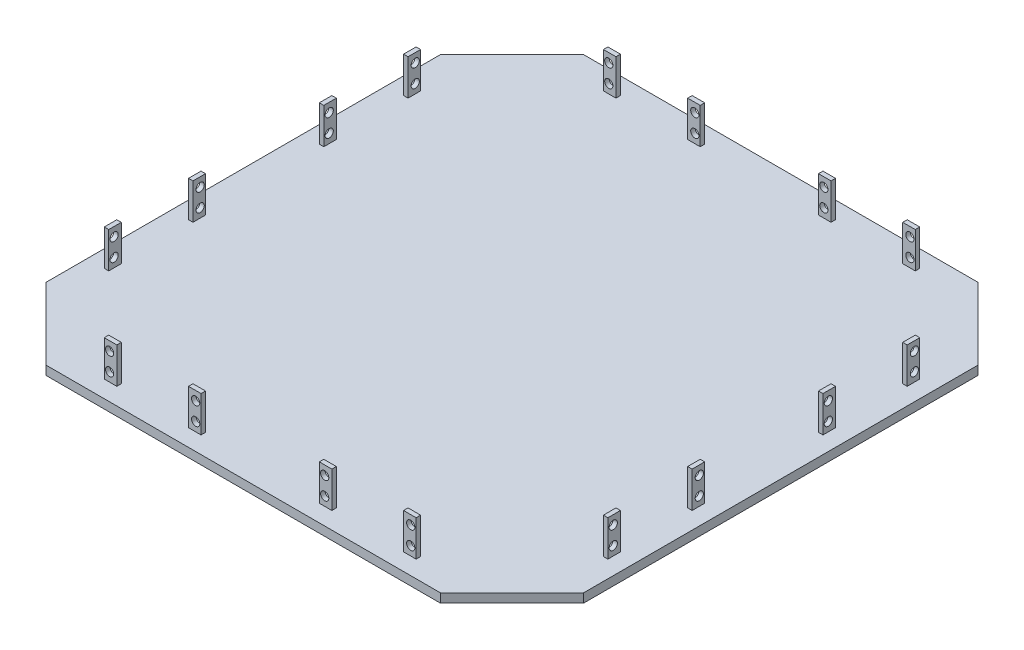
from build123d import *

# Parameters (mm, degrees)
EXTRUDE_1_DEPTH     = 5
SKETCH_1_5_W        = 7
SKETCH_1_5_H        = 2.5
SKETCH_1_5_W_2      = 2.5
SKETCH_1_5_H_2      = 7
EXTRUDE_2_DEPTH     = 25
SKETCH_2_R          = 2.3
CUT_EXTRUDE_3_DEPTH = 10
CUT_EXTRUDE_START   = -10
SKETCH_6_R          = 2.3
CUT_EXTRUDE_5_DEPTH = 10
SKETCH_7_R          = 2.3
CUT_EXTRUDE_4_DEPTH = 10
SKETCH_16_R         = 2.3
CUT_EXTRUDE_2_DEPTH = 10


with BuildPart() as part:
    # 草图1 → 凸台-拉伸1 (new body)
    with BuildSketch(Plane(origin=(0, 0, 0), x_dir=(1, 0, 0), z_dir=(0, 1, 0))):
        Polygon((-110, 150), (-150, 110), (-150, -110), (-110, -150), (110, -150), (150, -110), (150, 110), (110, 150), align=None)
    extrude(amount=EXTRUDE_1_DEPTH)

    # 草图1<5> → 凸台-拉伸2 (add)
    with BuildSketch(Plane(origin=(0, 0, 0), x_dir=(1, 0, 0), z_dir=(0, 1, 0))):
        with Locations((-83.5, 139.25)):
            Rectangle(SKETCH_1_5_W, SKETCH_1_5_H)
        with Locations((-139.25, 83.5)):
            Rectangle(SKETCH_1_5_W_2, SKETCH_1_5_H_2)
        with Locations((-36.5, 139.25)):
            Rectangle(SKETCH_1_5_W, SKETCH_1_5_H)
        with Locations((-139.25, 36.5)):
            Rectangle(SKETCH_1_5_W_2, SKETCH_1_5_H_2)
        with Locations((36.5, 139.25)):
            Rectangle(SKETCH_1_5_W, SKETCH_1_5_H)
        with Locations((-139.25, -36.5)):
            Rectangle(SKETCH_1_5_W_2, SKETCH_1_5_H_2)
        with Locations((83.5, 139.25)):
            Rectangle(SKETCH_1_5_W, SKETCH_1_5_H)
        with Locations((-139.25, -83.5)):
            Rectangle(SKETCH_1_5_W_2, SKETCH_1_5_H_2)
        with Locations((139.25, 83.5)):
            Rectangle(SKETCH_1_5_W_2, SKETCH_1_5_H_2)
        with Locations((-83.5, -139.25)):
            Rectangle(SKETCH_1_5_W, SKETCH_1_5_H)
        with Locations((139.25, 36.5)):
            Rectangle(SKETCH_1_5_W_2, SKETCH_1_5_H_2)
        with Locations((-36.5, -139.25)):
            Rectangle(SKETCH_1_5_W, SKETCH_1_5_H)
        with Locations((139.25, -36.5)):
            Rectangle(SKETCH_1_5_W_2, SKETCH_1_5_H_2)
        with Locations((36.5, -139.25)):
            Rectangle(SKETCH_1_5_W, SKETCH_1_5_H)
        with Locations((139.25, -83.5)):
            Rectangle(SKETCH_1_5_W_2, SKETCH_1_5_H_2)
        with Locations((83.5, -139.25)):
            Rectangle(SKETCH_1_5_W, SKETCH_1_5_H)
    extrude(amount=EXTRUDE_2_DEPTH)

    # 草图2 → 切除-拉伸3 (cut)
    with BuildSketch(Plane.XY.offset(140.5)):
        with Locations((-84, 20)):
            Circle(SKETCH_2_R)
        with Locations((-84, 10)):
            Circle(SKETCH_2_R)
        with Locations((-36, 20)):
            Circle(SKETCH_2_R)
        with Locations((-36, 10)):
            Circle(SKETCH_2_R)
        with Locations((36, 20)):
            Circle(SKETCH_2_R)
        with Locations((36, 10)):
            Circle(SKETCH_2_R)
        with Locations((84, 20)):
            Circle(SKETCH_2_R)
        with Locations((84, 10)):
            Circle(SKETCH_2_R)
    extrude(amount=-CUT_EXTRUDE_3_DEPTH, mode=Mode.SUBTRACT)

    # 草图6 → 切除-拉伸5 (cut)
    with BuildSketch(Plane(origin=(0, 0, -140.5), x_dir=(-1, 0, 0), z_dir=(0, 0, -1)).offset(CUT_EXTRUDE_START)):
        with Locations((-84, 20)):
            Circle(SKETCH_6_R)
        with Locations((-84, 10)):
            Circle(SKETCH_6_R)
        with Locations((-36, 20)):
            Circle(SKETCH_6_R)
        with Locations((-36, 10)):
            Circle(SKETCH_6_R)
        with Locations((36, 20)):
            Circle(SKETCH_6_R)
        with Locations((36, 10)):
            Circle(SKETCH_6_R)
        with Locations((84, 20)):
            Circle(SKETCH_6_R)
        with Locations((84, 10)):
            Circle(SKETCH_6_R)
    extrude(amount=CUT_EXTRUDE_5_DEPTH, mode=Mode.SUBTRACT)

    # 草图7 → 切除-拉伸4 (cut)
    with BuildSketch(Plane.ZY.offset(140.5)):
        with Locations((-84, 20)):
            Circle(SKETCH_7_R)
        with Locations((-84, 10)):
            Circle(SKETCH_7_R)
        with Locations((-36, 20)):
            Circle(SKETCH_7_R)
        with Locations((-36, 10)):
            Circle(SKETCH_7_R)
        with Locations((36, 20)):
            Circle(SKETCH_7_R)
        with Locations((36, 10)):
            Circle(SKETCH_7_R)
        with Locations((84, 20)):
            Circle(SKETCH_7_R)
        with Locations((84, 10)):
            Circle(SKETCH_7_R)
    extrude(amount=-CUT_EXTRUDE_4_DEPTH, mode=Mode.SUBTRACT)

    # 草图16 → 切除-拉伸2 (cut)
    with BuildSketch(Plane(origin=(140.5, 0, 0), x_dir=(0, 0, -1), z_dir=(1, 0, 0)).offset(CUT_EXTRUDE_START)):
        with Locations((-84, 20)):
            Circle(SKETCH_16_R)
        with Locations((-84, 10)):
            Circle(SKETCH_16_R)
        with Locations((-36, 20)):
            Circle(SKETCH_16_R)
        with Locations((-36, 10)):
            Circle(SKETCH_16_R)
        with Locations((36, 20)):
            Circle(SKETCH_16_R)
        with Locations((36, 10)):
            Circle(SKETCH_16_R)
        with Locations((84, 20)):
            Circle(SKETCH_16_R)
        with Locations((84, 10)):
            Circle(SKETCH_16_R)
    extrude(amount=CUT_EXTRUDE_2_DEPTH, mode=Mode.SUBTRACT)


solid = part.part
